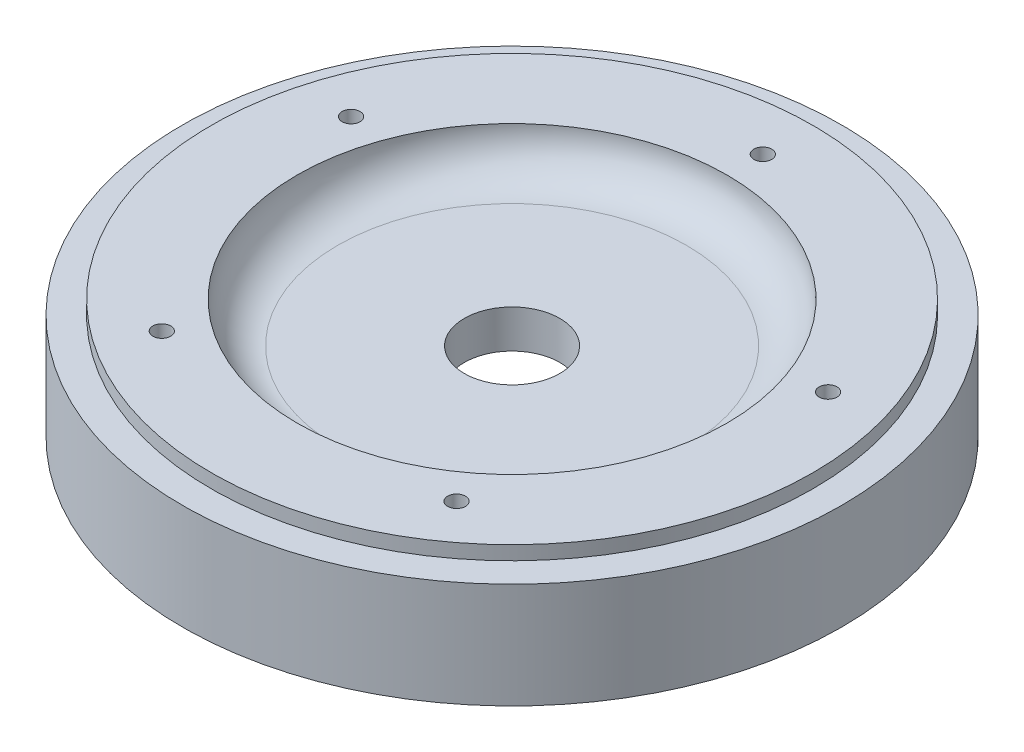
from build123d import *

# Parameters (mm, degrees)
F_1_1_DIAMETER_HOLE1_D = 25.4
CIRPATTERN1_COUNT      = 5
FILLET2_R              = 10.795


with BuildPart() as part:
    # Sketch1 → Revolve1 (revolve)
    with BuildSketch(Plane.XY):
        Polygon((87.63, 0), (57.15, 0), (57.15, 10.795), (0, 10.795), (0, 20.955), (57.15, 20.955), (57.15, 31.75), (79.9973, 31.75), (79.9973, 28.0416), (87.63, 28.0416), align=None)
    revolve(axis=Axis((0, 10.795, 0), (0, 1, 0)))

    # 1 (1) Diameter Hole1 (through all)
    with Locations(Plane(origin=(0, 20.955, 0), x_dir=(1, 0, 0), z_dir=(0, 1, 0))):
        with Locations((0, 0)):
            Hole(F_1_1_DIAMETER_HOLE1_D / 2)

    # Sketch7 → 3/16 (0.187) Dowel Hole1 (revolve, cut)
    with BuildSketch(Plane(origin=(0, 31.75, -66.675), x_dir=(0, 0, 1), z_dir=(1, 0, 0))):
        Polygon((0, 0), (0, 11.078983884), (2.3749, 9.652), (2.3749, 0), align=None)
    f_3_16_0_187_dowel_hole1 = revolve(axis=Axis((0, 38.1, -66.675), (0, -1, 0)), mode=Mode.SUBTRACT)

    # CirPattern1: 3/16 (0.187) Dowel Hole1 ×5 about axis
    cirpattern1_axis = Axis((0, 0, 0), (0, 1, 0))
    for i in range(1, CIRPATTERN1_COUNT):
        add(f_3_16_0_187_dowel_hole1.rotate(cirpattern1_axis, i * 360 / CIRPATTERN1_COUNT), mode=Mode.SUBTRACT)

    # Fillet2
    fillet2_edges = [part.edges().sort_by_distance(p)[0] for p in [
        (-57.15, 10.795, 0),
        (-57.15, 20.955, 0),
    ]]
    fillet(fillet2_edges, radius=FILLET2_R - 0.0001)  # a hair under: the kernel refuses the full size


solid = part.part
